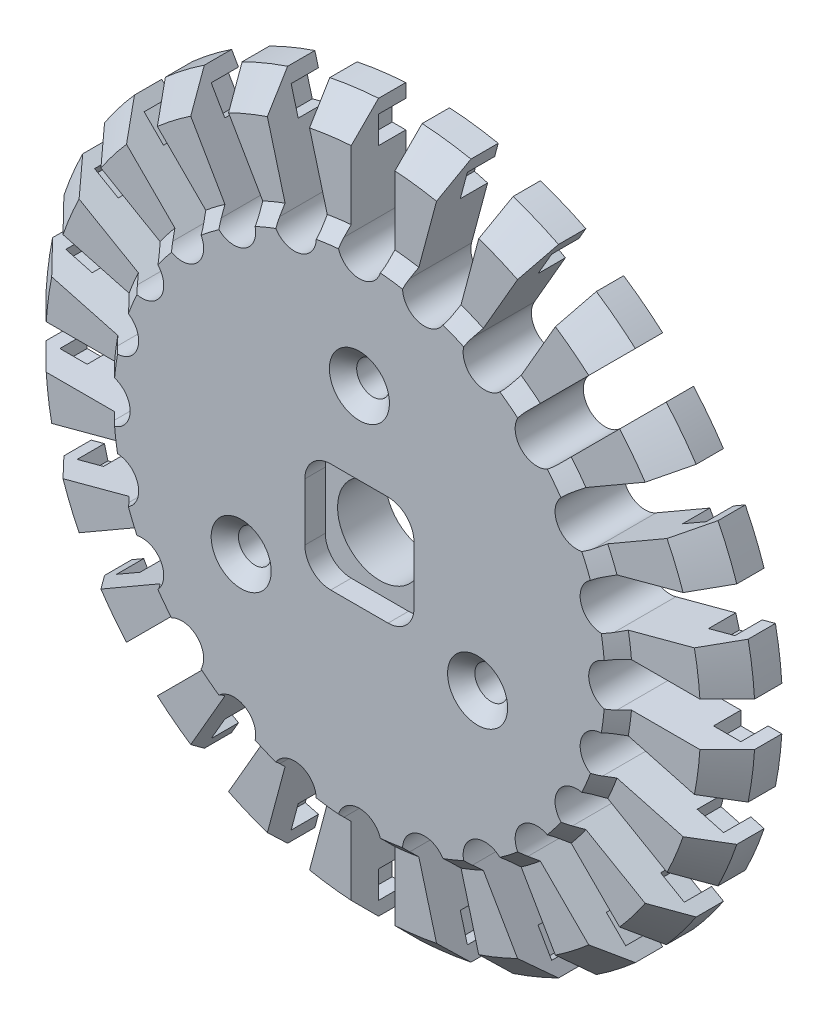
from build123d import *

# Parameters (mm, degrees)
ESBO_O1_R                                            = 26
RESSALTO_EXTRUS_O1_DEPTH                             = 4
CORTE_EXTRUS_O1_DEPTH                                = 37.986484018
ESBO_O8_R                                            = 19
RESSALTO_EXTRUS_O2_DEPTH                             = 1
ESBO_O11_R                                           = 3.1
CORTE_EXTRUS_O3_DEPTH                                = 38.038898472
CHANFRO4_SIZE                                        = 1
ESBO_O4_W                                            = 2
ESBO_O4_H                                            = 1
ESBO_O4_W_2                                          = 1
ESBO_O4_H_2                                          = 2
CORTE_EXTRUS_O4_DEPTH                                = 2
CORTE_EXTRUS_O6_START                                = -2
CORTE_EXTRUS_O6_DEPTH                                = 2
ESCAREADO_PARA_PARAFUSO_COM_CABE_A_ESCAR_D           = 2.4
ESCAREADO_PARA_PARAFUSO_COM_CABE_A_ESCAR_CSINK_D     = 4.4
ESCAREADO_PARA_PARAFUSO_COM_CABE_A_ESCAR_CSINK_ANGLE = 90
ESBO_O34_W                                           = 8
ESBO_O34_H                                           = 8
CORTE_EXTRUS_O7_DEPTH                                = 1.5
FILETE1_R                                            = 1.9


with BuildPart() as part:
    # Esboço1 → Ressalto-extrusão1 (new body)
    with BuildSketch(Plane.XY):
        Circle(ESBO_O1_R)
    extrude(amount=RESSALTO_EXTRUS_O1_DEPTH)

    # Chanfro1: read off the stored shape, not the designer's step
    # Chanfro1 outline → Chanfro1 (revolve, cut)
    with BuildSketch(Plane.XZ):
        Polygon((26, 4), (24, 4), (26, 2), align=None)
    revolve(axis=Axis((0, 0, 0), (0, 0, 1)), mode=Mode.SUBTRACT)

    # Esboço3 → Corte-extrusão1 (cut, through all)
    with BuildSketch(Plane(origin=(0, 0, 0), x_dir=(-1, 0, 0), z_dir=(0, 0, -1))):
        with BuildLine():
            Line((18.4, -1.6), (25.950722533, -1.6))
            ThreePointArc((25.950722533, -1.6), (26, 0), (25.950722533, 1.6))
            Line((25.950722533, 1.6), (18.4, 1.6))
            ThreePointArc((18.4, 1.6), (16.8, 0), (18.4, -1.6))
        make_face()
        with BuildLine():
            Line((17.358924732, -6.307751752), (24.652362634, -8.262022548))
            ThreePointArc((24.652362634, -8.262022548), (25.114071484, -6.729295173), (25.480583578, -5.171059904))
            Line((25.480583578, -5.171059904), (18.187145676, -3.216789108))
            ThreePointArc((18.187145676, -3.216789108), (16.227553882, -4.348159958), (17.358924732, -6.307751752))
        make_face()
        with BuildLine():
            Line((15.13486743, -10.585640646), (21.67398496, -14.361001913))
            ThreePointArc((21.67398496, -14.361001913), (22.516660498, -13), (23.27398496, -11.589720621))
            Line((23.27398496, -11.589720621), (16.73486743, -7.814359354))
            ThreePointArc((16.73486743, -7.814359354), (14.549226784, -8.4), (15.13486743, -10.585640646))
        make_face()
        with BuildLine():
            Line((11.879393924, -14.142135624), (17.21856103, -19.48130273))
            ThreePointArc((17.21856103, -19.48130273), (18.384776311, -18.384776311), (19.48130273, -17.21856103))
            Line((19.48130273, -17.21856103), (14.142135624, -11.879393924))
            ThreePointArc((14.142135624, -11.879393924), (11.879393924, -11.879393924), (11.879393924, -14.142135624))
        make_face()
        with BuildLine():
            Line((7.814359354, -16.73486743), (11.589720621, -23.27398496))
            ThreePointArc((11.589720621, -23.27398496), (13, -22.516660498), (14.361001913, -21.67398496))
            Line((14.361001913, -21.67398496), (10.585640646, -15.13486743))
            ThreePointArc((10.585640646, -15.13486743), (8.4, -14.549226784), (7.814359354, -16.73486743))
        make_face()
        with BuildLine():
            Line((3.216789108, -18.187145676), (5.171059904, -25.480583578))
            ThreePointArc((5.171059904, -25.480583578), (6.729295173, -25.114071484), (8.262022548, -24.652362634))
            Line((8.262022548, -24.652362634), (6.307751752, -17.358924732))
            ThreePointArc((6.307751752, -17.358924732), (4.348159958, -16.227553882), (3.216789108, -18.187145676))
        make_face()
        with BuildLine():
            Line((-1.6, -18.4), (-1.6, -25.950722533))
            ThreePointArc((-1.6, -25.950722533), (0, -26), (1.6, -25.950722533))
            Line((1.6, -25.950722533), (1.6, -18.4))
            ThreePointArc((1.6, -18.4), (0, -16.8), (-1.6, -18.4))
        make_face()
        with BuildLine():
            Line((-6.307751752, -17.358924732), (-8.262022548, -24.652362634))
            ThreePointArc((-8.262022548, -24.652362634), (-6.729295173, -25.114071484), (-5.171059904, -25.480583578))
            Line((-5.171059904, -25.480583578), (-3.216789108, -18.187145676))
            ThreePointArc((-3.216789108, -18.187145676), (-4.348159958, -16.227553882), (-6.307751752, -17.358924732))
        make_face()
        with BuildLine():
            Line((-10.585640646, -15.13486743), (-14.361001913, -21.67398496))
            ThreePointArc((-14.361001913, -21.67398496), (-13, -22.516660498), (-11.589720621, -23.27398496))
            Line((-11.589720621, -23.27398496), (-7.814359354, -16.73486743))
            ThreePointArc((-7.814359354, -16.73486743), (-8.4, -14.549226784), (-10.585640646, -15.13486743))
        make_face()
        with BuildLine():
            Line((-14.142135624, -11.879393924), (-19.48130273, -17.21856103))
            ThreePointArc((-19.48130273, -17.21856103), (-18.384776311, -18.384776311), (-17.21856103, -19.48130273))
            Line((-17.21856103, -19.48130273), (-11.879393924, -14.142135624))
            ThreePointArc((-11.879393924, -14.142135624), (-11.879393924, -11.879393924), (-14.142135624, -11.879393924))
        make_face()
        with BuildLine():
            Line((-16.73486743, -7.814359354), (-23.27398496, -11.589720621))
            ThreePointArc((-23.27398496, -11.589720621), (-22.516660498, -13), (-21.67398496, -14.361001913))
            Line((-21.67398496, -14.361001913), (-15.13486743, -10.585640646))
            ThreePointArc((-15.13486743, -10.585640646), (-14.549226784, -8.4), (-16.73486743, -7.814359354))
        make_face()
        with BuildLine():
            Line((-18.187145676, -3.216789108), (-25.480583578, -5.171059904))
            ThreePointArc((-25.480583578, -5.171059904), (-25.114071484, -6.729295173), (-24.652362634, -8.262022548))
            Line((-24.652362634, -8.262022548), (-17.358924732, -6.307751752))
            ThreePointArc((-17.358924732, -6.307751752), (-16.227553882, -4.348159958), (-18.187145676, -3.216789108))
        make_face()
        with BuildLine():
            Line((-18.4, 1.6), (-25.950722533, 1.6))
            ThreePointArc((-25.950722533, 1.6), (-26, 0), (-25.950722533, -1.6))
            Line((-25.950722533, -1.6), (-18.4, -1.6))
            ThreePointArc((-18.4, -1.6), (-16.8, 0), (-18.4, 1.6))
        make_face()
        with BuildLine():
            Line((-17.358924732, 6.307751752), (-24.652362634, 8.262022548))
            ThreePointArc((-24.652362634, 8.262022548), (-25.114071484, 6.729295173), (-25.480583578, 5.171059904))
            Line((-25.480583578, 5.171059904), (-18.187145676, 3.216789108))
            ThreePointArc((-18.187145676, 3.216789108), (-16.227553882, 4.348159958), (-17.358924732, 6.307751752))
        make_face()
        with BuildLine():
            Line((-15.13486743, 10.585640646), (-21.67398496, 14.361001913))
            ThreePointArc((-21.67398496, 14.361001913), (-22.516660498, 13), (-23.27398496, 11.589720621))
            Line((-23.27398496, 11.589720621), (-16.73486743, 7.814359354))
            ThreePointArc((-16.73486743, 7.814359354), (-14.549226784, 8.4), (-15.13486743, 10.585640646))
        make_face()
        with BuildLine():
            Line((-11.879393924, 14.142135624), (-17.21856103, 19.48130273))
            ThreePointArc((-17.21856103, 19.48130273), (-18.384776311, 18.384776311), (-19.48130273, 17.21856103))
            Line((-19.48130273, 17.21856103), (-14.142135624, 11.879393924))
            ThreePointArc((-14.142135624, 11.879393924), (-11.879393924, 11.879393924), (-11.879393924, 14.142135624))
        make_face()
        with BuildLine():
            Line((-7.814359354, 16.73486743), (-11.589720621, 23.27398496))
            ThreePointArc((-11.589720621, 23.27398496), (-13, 22.516660498), (-14.361001913, 21.67398496))
            Line((-14.361001913, 21.67398496), (-10.585640646, 15.13486743))
            ThreePointArc((-10.585640646, 15.13486743), (-8.4, 14.549226784), (-7.814359354, 16.73486743))
        make_face()
        with BuildLine():
            Line((-3.216789108, 18.187145676), (-5.171059904, 25.480583578))
            ThreePointArc((-5.171059904, 25.480583578), (-6.729295173, 25.114071484), (-8.262022548, 24.652362634))
            Line((-8.262022548, 24.652362634), (-6.307751752, 17.358924732))
            ThreePointArc((-6.307751752, 17.358924732), (-4.348159958, 16.227553882), (-3.216789108, 18.187145676))
        make_face()
        with BuildLine():
            Line((1.6, 18.4), (1.6, 25.950722533))
            ThreePointArc((1.6, 25.950722533), (0, 26), (-1.6, 25.950722533))
            Line((-1.6, 25.950722533), (-1.6, 18.4))
            ThreePointArc((-1.6, 18.4), (0, 16.8), (1.6, 18.4))
        make_face()
        with BuildLine():
            Line((6.307751752, 17.358924732), (8.262022548, 24.652362634))
            ThreePointArc((8.262022548, 24.652362634), (6.729295173, 25.114071484), (5.171059904, 25.480583578))
            Line((5.171059904, 25.480583578), (3.216789108, 18.187145676))
            ThreePointArc((3.216789108, 18.187145676), (4.348159958, 16.227553882), (6.307751752, 17.358924732))
        make_face()
        with BuildLine():
            Line((10.585640646, 15.13486743), (14.361001913, 21.67398496))
            ThreePointArc((14.361001913, 21.67398496), (13, 22.516660498), (11.589720621, 23.27398496))
            Line((11.589720621, 23.27398496), (7.814359354, 16.73486743))
            ThreePointArc((7.814359354, 16.73486743), (8.4, 14.549226784), (10.585640646, 15.13486743))
        make_face()
        with BuildLine():
            Line((14.142135624, 11.879393924), (19.48130273, 17.21856103))
            ThreePointArc((19.48130273, 17.21856103), (18.384776311, 18.384776311), (17.21856103, 19.48130273))
            Line((17.21856103, 19.48130273), (11.879393924, 14.142135624))
            ThreePointArc((11.879393924, 14.142135624), (11.879393924, 11.879393924), (14.142135624, 11.879393924))
        make_face()
        with BuildLine():
            Line((16.73486743, 7.814359354), (23.27398496, 11.589720621))
            ThreePointArc((23.27398496, 11.589720621), (22.516660498, 13), (21.67398496, 14.361001913))
            Line((21.67398496, 14.361001913), (15.13486743, 10.585640646))
            ThreePointArc((15.13486743, 10.585640646), (14.549226784, 8.4), (16.73486743, 7.814359354))
        make_face()
        with BuildLine():
            Line((18.187145676, 3.216789108), (25.480583578, 5.171059904))
            ThreePointArc((25.480583578, 5.171059904), (25.114071484, 6.729295173), (24.652362634, 8.262022548))
            Line((24.652362634, 8.262022548), (17.358924732, 6.307751752))
            ThreePointArc((17.358924732, 6.307751752), (16.227553882, 4.348159958), (18.187145676, 3.216789108))
        make_face()
    extrude(amount=-CORTE_EXTRUS_O1_DEPTH, mode=Mode.SUBTRACT)

    # Esboço8 → Ressalto-extrusão2 (add)
    with BuildSketch(Plane.XY.offset(4)):
        with Locations(Location((0, 0, 0), (0, 0, 175.169371408))):
            Circle(ESBO_O8_R)
    extrude(amount=RESSALTO_EXTRUS_O2_DEPTH)

    # Esboço11 → Corte-extrusão3 (cut, through all)
    with BuildSketch(Plane.XY.offset(5)):
        Circle(ESBO_O11_R)
    extrude(amount=-CORTE_EXTRUS_O3_DEPTH, mode=Mode.SUBTRACT)

    # Chanfro4
    chanfro4_edges = [part.edges().sort_by_distance(p)[0] for p in [
        (18.932511719, -1.6, 5),
    ]]
    chamfer(chanfro4_edges, length=CHANFRO4_SIZE - 0.0001)  # a hair under: the kernel refuses the full size

    # Esboço4 → Corte-extrusão4 (cut)
    with BuildSketch(Plane(origin=(0, 0, 0), x_dir=(-1, 0, 0), z_dir=(0, 0, -1))):
        with Locations((23.946607275, 2.1)):
            Rectangle(ESBO_O4_W, ESBO_O4_H)
        with Locations((23.946607275, -2.1)):
            Rectangle(ESBO_O4_W, ESBO_O4_H)
        Polygon((22.578831065, -4.393537661), (22.83765011, -3.427611835), (24.769501763, -3.945249925), (24.510682718, -4.911175751), align=None)
        Polygon((23.423642728, -8.968064222), (21.491791076, -8.450426132), (21.750610121, -7.484500305), (23.682461773, -8.002138396), align=None)
        Polygon((20.672344831, -10.087662992), (21.172344831, -9.221637588), (22.904395639, -10.221637588), (22.404395639, -11.087662992), align=None)
        Polygon((20.304395639, -14.724969688), (18.572344831, -13.724969688), (19.072344831, -12.858944284), (20.804395639, -13.858944284), align=None)
        Polygon((17.35707246, -15.09433076), (18.064179241, -14.387223979), (19.478392803, -15.801437541), (18.771286022, -16.508544322), align=None)
        Polygon((15.801437541, -19.478392803), (14.387223979, -18.064179241), (15.09433076, -17.35707246), (16.508544322, -18.771286022), align=None)
        Polygon((12.858944284, -19.072344831), (13.724969688, -18.572344831), (14.724969688, -20.304395639), (13.858944284, -20.804395639), align=None)
        Polygon((10.221637588, -22.904395639), (9.221637588, -21.172344831), (10.087662992, -20.672344831), (11.087662992, -22.404395639), align=None)
        Polygon((7.484500305, -21.750610121), (8.450426132, -21.491791076), (8.968064222, -23.423642728), (8.002138396, -23.682461773), align=None)
        Polygon((3.945249925, -24.769501763), (3.427611835, -22.83765011), (4.393537661, -22.578831065), (4.911175751, -24.510682718), align=None)
        with Locations((2.1, -23.946607275)):
            Rectangle(ESBO_O4_W_2, ESBO_O4_H_2)
        with Locations((-2.1, -23.946607275)):
            Rectangle(ESBO_O4_W_2, ESBO_O4_H_2)
        Polygon((-4.393537661, -22.578831065), (-3.427611835, -22.83765011), (-3.945249925, -24.769501763), (-4.911175751, -24.510682718), align=None)
        Polygon((-8.968064222, -23.423642728), (-8.450426132, -21.491791076), (-7.484500305, -21.750610121), (-8.002138396, -23.682461773), align=None)
        Polygon((-10.087662992, -20.672344831), (-9.221637588, -21.172344831), (-10.221637588, -22.904395639), (-11.087662992, -22.404395639), align=None)
        Polygon((-14.724969688, -20.304395639), (-13.724969688, -18.572344831), (-12.858944284, -19.072344831), (-13.858944284, -20.804395639), align=None)
        Polygon((-15.09433076, -17.35707246), (-14.387223979, -18.064179241), (-15.801437541, -19.478392803), (-16.508544322, -18.771286022), align=None)
        Polygon((-19.478392803, -15.801437541), (-18.064179241, -14.387223979), (-17.35707246, -15.09433076), (-18.771286022, -16.508544322), align=None)
        Polygon((-19.072344831, -12.858944284), (-18.572344831, -13.724969688), (-20.304395639, -14.724969688), (-20.804395639, -13.858944284), align=None)
        Polygon((-22.904395639, -10.221637588), (-21.172344831, -9.221637588), (-20.672344831, -10.087662992), (-22.404395639, -11.087662992), align=None)
        Polygon((-21.750610121, -7.484500305), (-21.491791076, -8.450426132), (-23.423642728, -8.968064222), (-23.682461773, -8.002138396), align=None)
        Polygon((-24.769501763, -3.945249925), (-22.83765011, -3.427611835), (-22.578831065, -4.393537661), (-24.510682718, -4.911175751), align=None)
        with Locations((-23.946607275, -2.1)):
            Rectangle(ESBO_O4_W, ESBO_O4_H)
        with Locations((-23.946607275, 2.1)):
            Rectangle(ESBO_O4_W, ESBO_O4_H)
        Polygon((-22.578831065, 4.393537661), (-22.83765011, 3.427611835), (-24.769501763, 3.945249925), (-24.510682718, 4.911175751), align=None)
        Polygon((-23.423642728, 8.968064222), (-21.491791076, 8.450426132), (-21.750610121, 7.484500305), (-23.682461773, 8.002138396), align=None)
        Polygon((-20.672344831, 10.087662992), (-21.172344831, 9.221637588), (-22.904395639, 10.221637588), (-22.404395639, 11.087662992), align=None)
        Polygon((-20.304395639, 14.724969688), (-18.572344831, 13.724969688), (-19.072344831, 12.858944284), (-20.804395639, 13.858944284), align=None)
        Polygon((-17.35707246, 15.09433076), (-18.064179241, 14.387223979), (-19.478392803, 15.801437541), (-18.771286022, 16.508544322), align=None)
        Polygon((-15.801437541, 19.478392803), (-14.387223979, 18.064179241), (-15.09433076, 17.35707246), (-16.508544322, 18.771286022), align=None)
        Polygon((-12.858944284, 19.072344831), (-13.724969688, 18.572344831), (-14.724969688, 20.304395639), (-13.858944284, 20.804395639), align=None)
        Polygon((-10.221637588, 22.904395639), (-9.221637588, 21.172344831), (-10.087662992, 20.672344831), (-11.087662992, 22.404395639), align=None)
        Polygon((-7.484500305, 21.750610121), (-8.450426132, 21.491791076), (-8.968064222, 23.423642728), (-8.002138396, 23.682461773), align=None)
        Polygon((-3.945249925, 24.769501763), (-3.427611835, 22.83765011), (-4.393537661, 22.578831065), (-4.911175751, 24.510682718), align=None)
        with Locations((-2.1, 23.946607275)):
            Rectangle(ESBO_O4_W_2, ESBO_O4_H_2)
        with Locations((2.1, 23.946607275)):
            Rectangle(ESBO_O4_W_2, ESBO_O4_H_2)
        Polygon((4.393537661, 22.578831065), (3.427611835, 22.83765011), (3.945249925, 24.769501763), (4.911175751, 24.510682718), align=None)
        Polygon((8.968064222, 23.423642728), (8.450426132, 21.491791076), (7.484500305, 21.750610121), (8.002138396, 23.682461773), align=None)
        Polygon((10.087662992, 20.672344831), (9.221637588, 21.172344831), (10.221637588, 22.904395639), (11.087662992, 22.404395639), align=None)
        Polygon((14.724969688, 20.304395639), (13.724969688, 18.572344831), (12.858944284, 19.072344831), (13.858944284, 20.804395639), align=None)
        Polygon((15.09433076, 17.35707246), (14.387223979, 18.064179241), (15.801437541, 19.478392803), (16.508544322, 18.771286022), align=None)
        Polygon((19.478392803, 15.801437541), (18.064179241, 14.387223979), (17.35707246, 15.09433076), (18.771286022, 16.508544322), align=None)
        Polygon((19.072344831, 12.858944284), (18.572344831, 13.724969688), (20.304395639, 14.724969688), (20.804395639, 13.858944284), align=None)
        Polygon((22.904395639, 10.221637588), (21.172344831, 9.221637588), (20.672344831, 10.087662992), (22.404395639, 11.087662992), align=None)
        Polygon((21.750610121, 7.484500305), (21.491791076, 8.450426132), (23.423642728, 8.968064222), (23.682461773, 8.002138396), align=None)
        Polygon((24.769501763, 3.945249925), (22.83765011, 3.427611835), (22.578831065, 4.393537661), (24.510682718, 4.911175751), align=None)
    extrude(amount=-CORTE_EXTRUS_O4_DEPTH, mode=Mode.SUBTRACT)

    # Corte-extrusão6: read off the stored shape, not the designer's step
    # Corte-extrusão6 outline → Corte-extrusão6 (cut)
    with BuildSketch(Plane(origin=(0, 0, 4), x_dir=(-1, 0, 0), z_dir=(0, 0, -1)).offset(CORTE_EXTRUS_O6_START)):
        with BuildLine():
            Line((24.946607275, -1.6), (25.950722533, -1.6))
            ThreePointArc((25.950722533, -1.6), (26, 0), (25.950722533, 1.6))
            Line((25.950722533, 1.6), (24.946607275, 1.6))
            Line((24.946607275, 1.6), (24.946607275, 2.6))
            Line((24.946607275, 2.6), (22.946607275, 2.6))
            Line((22.946607275, 2.6), (22.946607275, 1.6))
            Line((22.946607275, 1.6), (18.4, 1.6))
            ThreePointArc((18.4, 1.6), (16.8, 0), (18.4, -1.6))
            Line((18.4, -1.6), (22.946607275, -1.6))
            Line((22.946607275, -1.6), (22.946607275, -2.6))
            Line((22.946607275, -2.6), (24.946607275, -2.6))
            Line((24.946607275, -2.6), (24.946607275, -1.6))
        make_face()
        with BuildLine():
            ThreePointArc((24.652362634, -8.262022548), (25.114071484, -6.729295173), (25.480583578, -5.171059904))
            Line((25.480583578, -5.171059904), (24.510682718, -4.911175751))
            Line((24.510682718, -4.911175751), (24.769501763, -3.945249925))
            Line((24.769501763, -3.945249925), (22.83765011, -3.427611835))
            Line((22.83765011, -3.427611835), (22.578831065, -4.393537661))
            Line((22.578831065, -4.393537661), (18.187145676, -3.216789108))
            ThreePointArc((18.187145676, -3.216789108), (16.227553882, -4.348159958), (17.358924732, -6.307751752))
            Line((17.358924732, -6.307751752), (21.750610121, -7.484500305))
            Line((21.750610121, -7.484500305), (21.491791076, -8.450426132))
            Line((21.491791076, -8.450426132), (23.423642728, -8.968064222))
            Line((23.423642728, -8.968064222), (23.682461773, -8.002138396))
            Line((23.682461773, -8.002138396), (24.652362634, -8.262022548))
        make_face()
        with BuildLine():
            ThreePointArc((21.67398496, -14.361001913), (22.516660498, -13), (23.27398496, -11.589720621))
            Line((23.27398496, -11.589720621), (22.404395639, -11.087662992))
            Line((22.404395639, -11.087662992), (22.904395639, -10.221637588))
            Line((22.904395639, -10.221637588), (21.172344831, -9.221637588))
            Line((21.172344831, -9.221637588), (20.672344831, -10.087662992))
            Line((20.672344831, -10.087662992), (16.73486743, -7.814359354))
            ThreePointArc((16.73486743, -7.814359354), (14.549226784, -8.4), (15.13486743, -10.585640646))
            Line((15.13486743, -10.585640646), (19.072344831, -12.858944284))
            Line((19.072344831, -12.858944284), (18.572344831, -13.724969688))
            Line((18.572344831, -13.724969688), (20.304395639, -14.724969688))
            Line((20.304395639, -14.724969688), (20.804395639, -13.858944284))
            Line((20.804395639, -13.858944284), (21.67398496, -14.361001913))
        make_face()
        with BuildLine():
            Line((24.510682718, 4.911175751), (25.480583578, 5.171059904))
            ThreePointArc((25.480583578, 5.171059904), (25.114071484, 6.729295173), (24.652362634, 8.262022548))
            Line((24.652362634, 8.262022548), (23.682461773, 8.002138396))
            Line((23.682461773, 8.002138396), (23.423642728, 8.968064222))
            Line((23.423642728, 8.968064222), (21.491791076, 8.450426132))
            Line((21.491791076, 8.450426132), (21.750610121, 7.484500305))
            Line((21.750610121, 7.484500305), (17.358924732, 6.307751752))
            ThreePointArc((17.358924732, 6.307751752), (16.227553882, 4.348159958), (18.187145676, 3.216789108))
            Line((18.187145676, 3.216789108), (22.578831065, 4.393537661))
            Line((22.578831065, 4.393537661), (22.83765011, 3.427611835))
            Line((22.83765011, 3.427611835), (24.769501763, 3.945249925))
            Line((24.769501763, 3.945249925), (24.510682718, 4.911175751))
        make_face()
        with BuildLine():
            ThreePointArc((17.21856103, -19.48130273), (18.384776311, -18.384776311), (19.48130273, -17.21856103))
            Line((19.48130273, -17.21856103), (18.771286022, -16.508544322))
            Line((18.771286022, -16.508544322), (19.478392803, -15.801437541))
            Line((19.478392803, -15.801437541), (18.064179241, -14.387223979))
            Line((18.064179241, -14.387223979), (17.35707246, -15.09433076))
            Line((17.35707246, -15.09433076), (14.142135624, -11.879393924))
            ThreePointArc((14.142135624, -11.879393924), (11.879393924, -11.879393924), (11.879393924, -14.142135624))
            Line((11.879393924, -14.142135624), (15.09433076, -17.35707246))
            Line((15.09433076, -17.35707246), (14.387223979, -18.064179241))
            Line((14.387223979, -18.064179241), (15.801437541, -19.478392803))
            Line((15.801437541, -19.478392803), (16.508544322, -18.771286022))
            Line((16.508544322, -18.771286022), (17.21856103, -19.48130273))
        make_face()
        with BuildLine():
            Line((22.404395639, 11.087662992), (23.27398496, 11.589720621))
            ThreePointArc((23.27398496, 11.589720621), (22.516660498, 13), (21.67398496, 14.361001913))
            Line((21.67398496, 14.361001913), (20.804395639, 13.858944284))
            Line((20.804395639, 13.858944284), (20.304395639, 14.724969688))
            Line((20.304395639, 14.724969688), (18.572344831, 13.724969688))
            Line((18.572344831, 13.724969688), (19.072344831, 12.858944284))
            Line((19.072344831, 12.858944284), (15.13486743, 10.585640646))
            ThreePointArc((15.13486743, 10.585640646), (14.549226784, 8.4), (16.73486743, 7.814359354))
            Line((16.73486743, 7.814359354), (20.672344831, 10.087662992))
            Line((20.672344831, 10.087662992), (21.172344831, 9.221637588))
            Line((21.172344831, 9.221637588), (22.904395639, 10.221637588))
            Line((22.904395639, 10.221637588), (22.404395639, 11.087662992))
        make_face()
        with BuildLine():
            ThreePointArc((11.589720621, -23.27398496), (13, -22.516660498), (14.361001913, -21.67398496))
            Line((14.361001913, -21.67398496), (13.858944284, -20.804395639))
            Line((13.858944284, -20.804395639), (14.724969688, -20.304395639))
            Line((14.724969688, -20.304395639), (13.724969688, -18.572344831))
            Line((13.724969688, -18.572344831), (12.858944284, -19.072344831))
            Line((12.858944284, -19.072344831), (10.585640646, -15.13486743))
            ThreePointArc((10.585640646, -15.13486743), (8.4, -14.549226784), (7.814359354, -16.73486743))
            Line((7.814359354, -16.73486743), (10.087662992, -20.672344831))
            Line((10.087662992, -20.672344831), (9.221637588, -21.172344831))
            Line((9.221637588, -21.172344831), (10.221637588, -22.904395639))
            Line((10.221637588, -22.904395639), (11.087662992, -22.404395639))
            Line((11.087662992, -22.404395639), (11.589720621, -23.27398496))
        make_face()
        with BuildLine():
            Line((18.771286022, 16.508544322), (19.48130273, 17.21856103))
            ThreePointArc((19.48130273, 17.21856103), (18.384776311, 18.384776311), (17.21856103, 19.48130273))
            Line((17.21856103, 19.48130273), (16.508544322, 18.771286022))
            Line((16.508544322, 18.771286022), (15.801437541, 19.478392803))
            Line((15.801437541, 19.478392803), (14.387223979, 18.064179241))
            Line((14.387223979, 18.064179241), (15.09433076, 17.35707246))
            Line((15.09433076, 17.35707246), (11.879393924, 14.142135624))
            ThreePointArc((11.879393924, 14.142135624), (11.879393924, 11.879393924), (14.142135624, 11.879393924))
            Line((14.142135624, 11.879393924), (17.35707246, 15.09433076))
            Line((17.35707246, 15.09433076), (18.064179241, 14.387223979))
            Line((18.064179241, 14.387223979), (19.478392803, 15.801437541))
            Line((19.478392803, 15.801437541), (18.771286022, 16.508544322))
        make_face()
        with BuildLine():
            ThreePointArc((5.171059904, -25.480583578), (6.729295173, -25.114071484), (8.262022548, -24.652362634))
            Line((8.262022548, -24.652362634), (8.002138396, -23.682461773))
            Line((8.002138396, -23.682461773), (8.968064222, -23.423642728))
            Line((8.968064222, -23.423642728), (8.450426132, -21.491791076))
            Line((8.450426132, -21.491791076), (7.484500305, -21.750610121))
            Line((7.484500305, -21.750610121), (6.307751752, -17.358924732))
            ThreePointArc((6.307751752, -17.358924732), (4.348159958, -16.227553882), (3.216789108, -18.187145676))
            Line((3.216789108, -18.187145676), (4.393537661, -22.578831065))
            Line((4.393537661, -22.578831065), (3.427611835, -22.83765011))
            Line((3.427611835, -22.83765011), (3.945249925, -24.769501763))
            Line((3.945249925, -24.769501763), (4.911175751, -24.510682718))
            Line((4.911175751, -24.510682718), (5.171059904, -25.480583578))
        make_face()
        with BuildLine():
            Line((13.858944284, 20.804395639), (14.361001913, 21.67398496))
            ThreePointArc((14.361001913, 21.67398496), (13, 22.516660498), (11.589720621, 23.27398496))
            Line((11.589720621, 23.27398496), (11.087662992, 22.404395639))
            Line((11.087662992, 22.404395639), (10.221637588, 22.904395639))
            Line((10.221637588, 22.904395639), (9.221637588, 21.172344831))
            Line((9.221637588, 21.172344831), (10.087662992, 20.672344831))
            Line((10.087662992, 20.672344831), (7.814359354, 16.73486743))
            ThreePointArc((7.814359354, 16.73486743), (8.4, 14.549226784), (10.585640646, 15.13486743))
            Line((10.585640646, 15.13486743), (12.858944284, 19.072344831))
            Line((12.858944284, 19.072344831), (13.724969688, 18.572344831))
            Line((13.724969688, 18.572344831), (14.724969688, 20.304395639))
            Line((14.724969688, 20.304395639), (13.858944284, 20.804395639))
        make_face()
        with BuildLine():
            ThreePointArc((-1.6, -25.950722533), (0, -26), (1.6, -25.950722533))
            Line((1.6, -25.950722533), (1.6, -24.946607275))
            Line((1.6, -24.946607275), (2.6, -24.946607275))
            Line((2.6, -24.946607275), (2.6, -22.946607275))
            Line((2.6, -22.946607275), (1.6, -22.946607275))
            Line((1.6, -22.946607275), (1.6, -18.4))
            ThreePointArc((1.6, -18.4), (0, -16.8), (-1.6, -18.4))
            Line((-1.6, -18.4), (-1.6, -22.946607275))
            Line((-1.6, -22.946607275), (-2.6, -22.946607275))
            Line((-2.6, -22.946607275), (-2.6, -24.946607275))
            Line((-2.6, -24.946607275), (-1.6, -24.946607275))
            Line((-1.6, -24.946607275), (-1.6, -25.950722533))
        make_face()
        with BuildLine():
            Line((8.002138396, 23.682461773), (8.262022548, 24.652362634))
            ThreePointArc((8.262022548, 24.652362634), (6.729295173, 25.114071484), (5.171059904, 25.480583578))
            Line((5.171059904, 25.480583578), (4.911175751, 24.510682718))
            Line((4.911175751, 24.510682718), (3.945249925, 24.769501763))
            Line((3.945249925, 24.769501763), (3.427611835, 22.83765011))
            Line((3.427611835, 22.83765011), (4.393537661, 22.578831065))
            Line((4.393537661, 22.578831065), (3.216789108, 18.187145676))
            ThreePointArc((3.216789108, 18.187145676), (4.348159958, 16.227553882), (6.307751752, 17.358924732))
            Line((6.307751752, 17.358924732), (7.484500305, 21.750610121))
            Line((7.484500305, 21.750610121), (8.450426132, 21.491791076))
            Line((8.450426132, 21.491791076), (8.968064222, 23.423642728))
            Line((8.968064222, 23.423642728), (8.002138396, 23.682461773))
        make_face()
        with BuildLine():
            ThreePointArc((-8.262022548, -24.652362634), (-6.729295173, -25.114071484), (-5.171059904, -25.480583578))
            Line((-5.171059904, -25.480583578), (-4.911175751, -24.510682718))
            Line((-4.911175751, -24.510682718), (-3.945249925, -24.769501763))
            Line((-3.945249925, -24.769501763), (-3.427611835, -22.83765011))
            Line((-3.427611835, -22.83765011), (-4.393537661, -22.578831065))
            Line((-4.393537661, -22.578831065), (-3.216789108, -18.187145676))
            ThreePointArc((-3.216789108, -18.187145676), (-4.348159958, -16.227553882), (-6.307751752, -17.358924732))
            Line((-6.307751752, -17.358924732), (-7.484500305, -21.750610121))
            Line((-7.484500305, -21.750610121), (-8.450426132, -21.491791076))
            Line((-8.450426132, -21.491791076), (-8.968064222, -23.423642728))
            Line((-8.968064222, -23.423642728), (-8.002138396, -23.682461773))
            Line((-8.002138396, -23.682461773), (-8.262022548, -24.652362634))
        make_face()
        with BuildLine():
            Line((1.6, 24.946607275), (1.6, 25.950722533))
            ThreePointArc((1.6, 25.950722533), (0, 26), (-1.6, 25.950722533))
            Line((-1.6, 25.950722533), (-1.6, 24.946607275))
            Line((-1.6, 24.946607275), (-2.6, 24.946607275))
            Line((-2.6, 24.946607275), (-2.6, 22.946607275))
            Line((-2.6, 22.946607275), (-1.6, 22.946607275))
            Line((-1.6, 22.946607275), (-1.6, 18.4))
            ThreePointArc((-1.6, 18.4), (0, 16.8), (1.6, 18.4))
            Line((1.6, 18.4), (1.6, 22.946607275))
            Line((1.6, 22.946607275), (2.6, 22.946607275))
            Line((2.6, 22.946607275), (2.6, 24.946607275))
            Line((2.6, 24.946607275), (1.6, 24.946607275))
        make_face()
        with BuildLine():
            ThreePointArc((-14.361001913, -21.67398496), (-13, -22.516660498), (-11.589720621, -23.27398496))
            Line((-11.589720621, -23.27398496), (-11.087662992, -22.404395639))
            Line((-11.087662992, -22.404395639), (-10.221637588, -22.904395639))
            Line((-10.221637588, -22.904395639), (-9.221637588, -21.172344831))
            Line((-9.221637588, -21.172344831), (-10.087662992, -20.672344831))
            Line((-10.087662992, -20.672344831), (-7.814359354, -16.73486743))
            ThreePointArc((-7.814359354, -16.73486743), (-8.4, -14.549226784), (-10.585640646, -15.13486743))
            Line((-10.585640646, -15.13486743), (-12.858944284, -19.072344831))
            Line((-12.858944284, -19.072344831), (-13.724969688, -18.572344831))
            Line((-13.724969688, -18.572344831), (-14.724969688, -20.304395639))
            Line((-14.724969688, -20.304395639), (-13.858944284, -20.804395639))
            Line((-13.858944284, -20.804395639), (-14.361001913, -21.67398496))
        make_face()
        with BuildLine():
            Line((-4.911175751, 24.510682718), (-5.171059904, 25.480583578))
            ThreePointArc((-5.171059904, 25.480583578), (-6.729295173, 25.114071484), (-8.262022548, 24.652362634))
            Line((-8.262022548, 24.652362634), (-8.002138396, 23.682461773))
            Line((-8.002138396, 23.682461773), (-8.968064222, 23.423642728))
            Line((-8.968064222, 23.423642728), (-8.450426132, 21.491791076))
            Line((-8.450426132, 21.491791076), (-7.484500305, 21.750610121))
            Line((-7.484500305, 21.750610121), (-6.307751752, 17.358924732))
            ThreePointArc((-6.307751752, 17.358924732), (-4.348159958, 16.227553882), (-3.216789108, 18.187145676))
            Line((-3.216789108, 18.187145676), (-4.393537661, 22.578831065))
            Line((-4.393537661, 22.578831065), (-3.427611835, 22.83765011))
            Line((-3.427611835, 22.83765011), (-3.945249925, 24.769501763))
            Line((-3.945249925, 24.769501763), (-4.911175751, 24.510682718))
        make_face()
        with BuildLine():
            ThreePointArc((-19.48130273, -17.21856103), (-18.384776311, -18.384776311), (-17.21856103, -19.48130273))
            Line((-17.21856103, -19.48130273), (-16.508544322, -18.771286022))
            Line((-16.508544322, -18.771286022), (-15.801437541, -19.478392803))
            Line((-15.801437541, -19.478392803), (-14.387223979, -18.064179241))
            Line((-14.387223979, -18.064179241), (-15.09433076, -17.35707246))
            Line((-15.09433076, -17.35707246), (-11.879393924, -14.142135624))
            ThreePointArc((-11.879393924, -14.142135624), (-11.879393924, -11.879393924), (-14.142135624, -11.879393924))
            Line((-14.142135624, -11.879393924), (-17.35707246, -15.09433076))
            Line((-17.35707246, -15.09433076), (-18.064179241, -14.387223979))
            Line((-18.064179241, -14.387223979), (-19.478392803, -15.801437541))
            Line((-19.478392803, -15.801437541), (-18.771286022, -16.508544322))
            Line((-18.771286022, -16.508544322), (-19.48130273, -17.21856103))
        make_face()
        with BuildLine():
            Line((-11.087662992, 22.404395639), (-11.589720621, 23.27398496))
            ThreePointArc((-11.589720621, 23.27398496), (-13, 22.516660498), (-14.361001913, 21.67398496))
            Line((-14.361001913, 21.67398496), (-13.858944284, 20.804395639))
            Line((-13.858944284, 20.804395639), (-14.724969688, 20.304395639))
            Line((-14.724969688, 20.304395639), (-13.724969688, 18.572344831))
            Line((-13.724969688, 18.572344831), (-12.858944284, 19.072344831))
            Line((-12.858944284, 19.072344831), (-10.585640646, 15.13486743))
            ThreePointArc((-10.585640646, 15.13486743), (-8.4, 14.549226784), (-7.814359354, 16.73486743))
            Line((-7.814359354, 16.73486743), (-10.087662992, 20.672344831))
            Line((-10.087662992, 20.672344831), (-9.221637588, 21.172344831))
            Line((-9.221637588, 21.172344831), (-10.221637588, 22.904395639))
            Line((-10.221637588, 22.904395639), (-11.087662992, 22.404395639))
        make_face()
        with BuildLine():
            ThreePointArc((-23.27398496, -11.589720621), (-22.516660498, -13), (-21.67398496, -14.361001913))
            Line((-21.67398496, -14.361001913), (-20.804395639, -13.858944284))
            Line((-20.804395639, -13.858944284), (-20.304395639, -14.724969688))
            Line((-20.304395639, -14.724969688), (-18.572344831, -13.724969688))
            Line((-18.572344831, -13.724969688), (-19.072344831, -12.858944284))
            Line((-19.072344831, -12.858944284), (-15.13486743, -10.585640646))
            ThreePointArc((-15.13486743, -10.585640646), (-14.549226784, -8.4), (-16.73486743, -7.814359354))
            Line((-16.73486743, -7.814359354), (-20.672344831, -10.087662992))
            Line((-20.672344831, -10.087662992), (-21.172344831, -9.221637588))
            Line((-21.172344831, -9.221637588), (-22.904395639, -10.221637588))
            Line((-22.904395639, -10.221637588), (-22.404395639, -11.087662992))
            Line((-22.404395639, -11.087662992), (-23.27398496, -11.589720621))
        make_face()
        with BuildLine():
            Line((-16.508544322, 18.771286022), (-17.21856103, 19.48130273))
            ThreePointArc((-17.21856103, 19.48130273), (-18.384776311, 18.384776311), (-19.48130273, 17.21856103))
            Line((-19.48130273, 17.21856103), (-18.771286022, 16.508544322))
            Line((-18.771286022, 16.508544322), (-19.478392803, 15.801437541))
            Line((-19.478392803, 15.801437541), (-18.064179241, 14.387223979))
            Line((-18.064179241, 14.387223979), (-17.35707246, 15.09433076))
            Line((-17.35707246, 15.09433076), (-14.142135624, 11.879393924))
            ThreePointArc((-14.142135624, 11.879393924), (-11.879393924, 11.879393924), (-11.879393924, 14.142135624))
            Line((-11.879393924, 14.142135624), (-15.09433076, 17.35707246))
            Line((-15.09433076, 17.35707246), (-14.387223979, 18.064179241))
            Line((-14.387223979, 18.064179241), (-15.801437541, 19.478392803))
            Line((-15.801437541, 19.478392803), (-16.508544322, 18.771286022))
        make_face()
        with BuildLine():
            ThreePointArc((-25.480583578, -5.171059904), (-25.114071484, -6.729295173), (-24.652362634, -8.262022548))
            Line((-24.652362634, -8.262022548), (-23.682461773, -8.002138396))
            Line((-23.682461773, -8.002138396), (-23.423642728, -8.968064222))
            Line((-23.423642728, -8.968064222), (-21.491791076, -8.450426132))
            Line((-21.491791076, -8.450426132), (-21.750610121, -7.484500305))
            Line((-21.750610121, -7.484500305), (-17.358924732, -6.307751752))
            ThreePointArc((-17.358924732, -6.307751752), (-16.227553882, -4.348159958), (-18.187145676, -3.216789108))
            Line((-18.187145676, -3.216789108), (-22.578831065, -4.393537661))
            Line((-22.578831065, -4.393537661), (-22.83765011, -3.427611835))
            Line((-22.83765011, -3.427611835), (-24.769501763, -3.945249925))
            Line((-24.769501763, -3.945249925), (-24.510682718, -4.911175751))
            Line((-24.510682718, -4.911175751), (-25.480583578, -5.171059904))
        make_face()
        with BuildLine():
            Line((-20.804395639, 13.858944284), (-21.67398496, 14.361001913))
            ThreePointArc((-21.67398496, 14.361001913), (-22.516660498, 13), (-23.27398496, 11.589720621))
            Line((-23.27398496, 11.589720621), (-22.404395639, 11.087662992))
            Line((-22.404395639, 11.087662992), (-22.904395639, 10.221637588))
            Line((-22.904395639, 10.221637588), (-21.172344831, 9.221637588))
            Line((-21.172344831, 9.221637588), (-20.672344831, 10.087662992))
            Line((-20.672344831, 10.087662992), (-16.73486743, 7.814359354))
            ThreePointArc((-16.73486743, 7.814359354), (-14.549226784, 8.4), (-15.13486743, 10.585640646))
            Line((-15.13486743, 10.585640646), (-19.072344831, 12.858944284))
            Line((-19.072344831, 12.858944284), (-18.572344831, 13.724969688))
            Line((-18.572344831, 13.724969688), (-20.304395639, 14.724969688))
            Line((-20.304395639, 14.724969688), (-20.804395639, 13.858944284))
        make_face()
        with BuildLine():
            ThreePointArc((-25.950722533, 1.6), (-26, 0), (-25.950722533, -1.6))
            Line((-25.950722533, -1.6), (-24.946607275, -1.6))
            Line((-24.946607275, -1.6), (-24.946607275, -2.6))
            Line((-24.946607275, -2.6), (-22.946607275, -2.6))
            Line((-22.946607275, -2.6), (-22.946607275, -1.6))
            Line((-22.946607275, -1.6), (-18.4, -1.6))
            ThreePointArc((-18.4, -1.6), (-16.8, 0), (-18.4, 1.6))
            Line((-18.4, 1.6), (-22.946607275, 1.6))
            Line((-22.946607275, 1.6), (-22.946607275, 2.6))
            Line((-22.946607275, 2.6), (-24.946607275, 2.6))
            Line((-24.946607275, 2.6), (-24.946607275, 1.6))
            Line((-24.946607275, 1.6), (-25.950722533, 1.6))
        make_face()
        with BuildLine():
            Line((-23.682461773, 8.002138396), (-24.652362634, 8.262022548))
            ThreePointArc((-24.652362634, 8.262022548), (-25.114071484, 6.729295173), (-25.480583578, 5.171059904))
            Line((-25.480583578, 5.171059904), (-24.510682718, 4.911175751))
            Line((-24.510682718, 4.911175751), (-24.769501763, 3.945249925))
            Line((-24.769501763, 3.945249925), (-22.83765011, 3.427611835))
            Line((-22.83765011, 3.427611835), (-22.578831065, 4.393537661))
            Line((-22.578831065, 4.393537661), (-18.187145676, 3.216789108))
            ThreePointArc((-18.187145676, 3.216789108), (-16.227553882, 4.348159958), (-17.358924732, 6.307751752))
            Line((-17.358924732, 6.307751752), (-21.750610121, 7.484500305))
            Line((-21.750610121, 7.484500305), (-21.491791076, 8.450426132))
            Line((-21.491791076, 8.450426132), (-23.423642728, 8.968064222))
            Line((-23.423642728, 8.968064222), (-23.682461773, 8.002138396))
        make_face()
    extrude(amount=CORTE_EXTRUS_O6_DEPTH, mode=Mode.SUBTRACT)

    # Escareado para parafuso com cabeça escareada chata de M21 (through all)
    with Locations(Plane(origin=(-8.660254038, -5, 5), x_dir=(1, 0, 0), z_dir=(0, 0, 1))):
        with Locations((0, 0), (8.660254038, 15), (17.320508076, 0)):
            CounterSinkHole(ESCAREADO_PARA_PARAFUSO_COM_CABE_A_ESCAR_D / 2, ESCAREADO_PARA_PARAFUSO_COM_CABE_A_ESCAR_CSINK_D / 2, counter_sink_angle=ESCAREADO_PARA_PARAFUSO_COM_CABE_A_ESCAR_CSINK_ANGLE)

    # Esboço34 → Corte-extrusão7 (cut)
    with BuildSketch(Plane.XY.offset(5)):
        Rectangle(ESBO_O34_W, ESBO_O34_H)
    extrude(amount=-CORTE_EXTRUS_O7_DEPTH, mode=Mode.SUBTRACT)

    # Filete1
    filete1_edges = [part.edges().sort_by_distance(p)[0] for p in [
        (4, 4, 4.25),
        (4, -4, 4.25),
        (-4, -4, 4.25),
        (-4, 4, 4.25),
    ]]
    fillet(filete1_edges, radius=FILETE1_R)


solid = part.part
